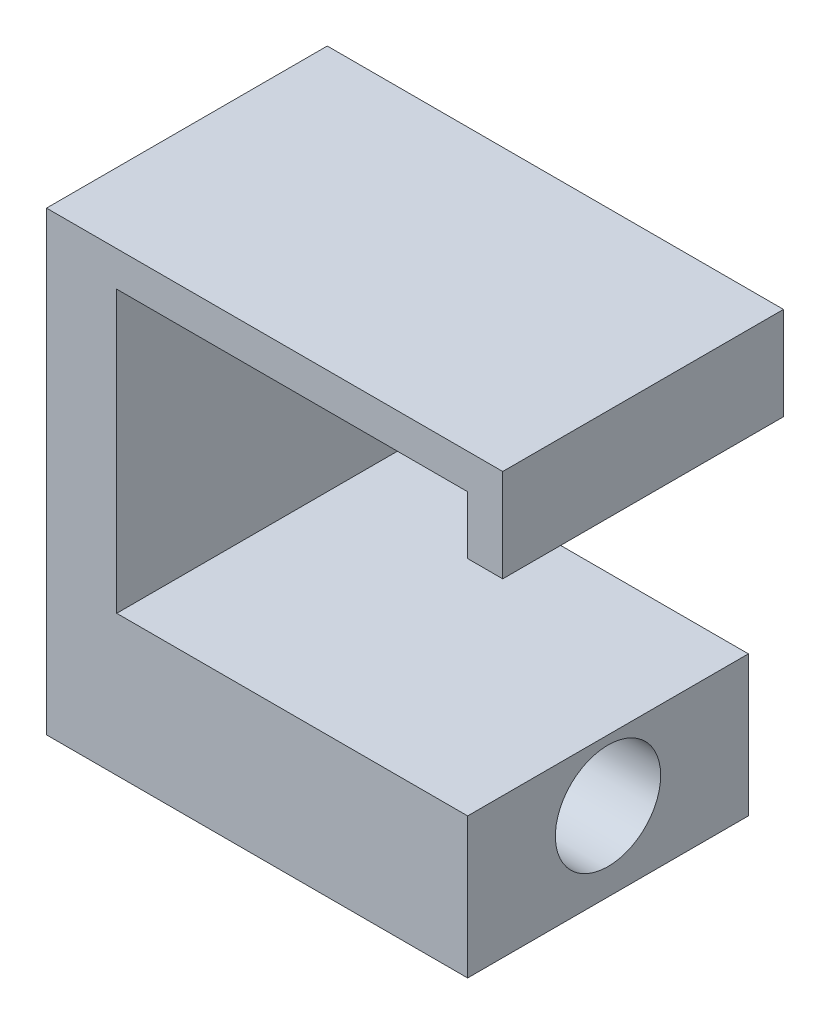
from build123d import *

# Parameters (mm, degrees)
BOSS_EXTRUDE1_DEPTH = 12.7
SKETCH2_R           = 2.38125
CUT_EXTRUDE2_DEPTH  = 26.769506636


with BuildPart() as part:
    # Sketch1 → Boss-Extrude1 (new body)
    with BuildSketch(Plane.XY):
        Polygon((11.033125, 4.60375), (12.620625, 4.60375), (12.620625, 8.810625), (-8.016875, 8.810625), (-8.016875, -11.826875), (11.033125, -11.826875), (11.033125, -5.476875), (-4.841875, -5.476875), (-4.841875, 7.223125), (11.033125, 7.223125), align=None)
    extrude(amount=BOSS_EXTRUDE1_DEPTH)

    # Sketch2 → Cut-Extrude2 (cut, through all)
    with BuildSketch(Plane(origin=(11.033125, 0, 0), x_dir=(0, 0, -1), z_dir=(1, 0, 0))):
        with Locations((-6.35, -8.255)):
            Circle(SKETCH2_R)
    extrude(amount=-CUT_EXTRUDE2_DEPTH, mode=Mode.SUBTRACT)


solid = part.part
